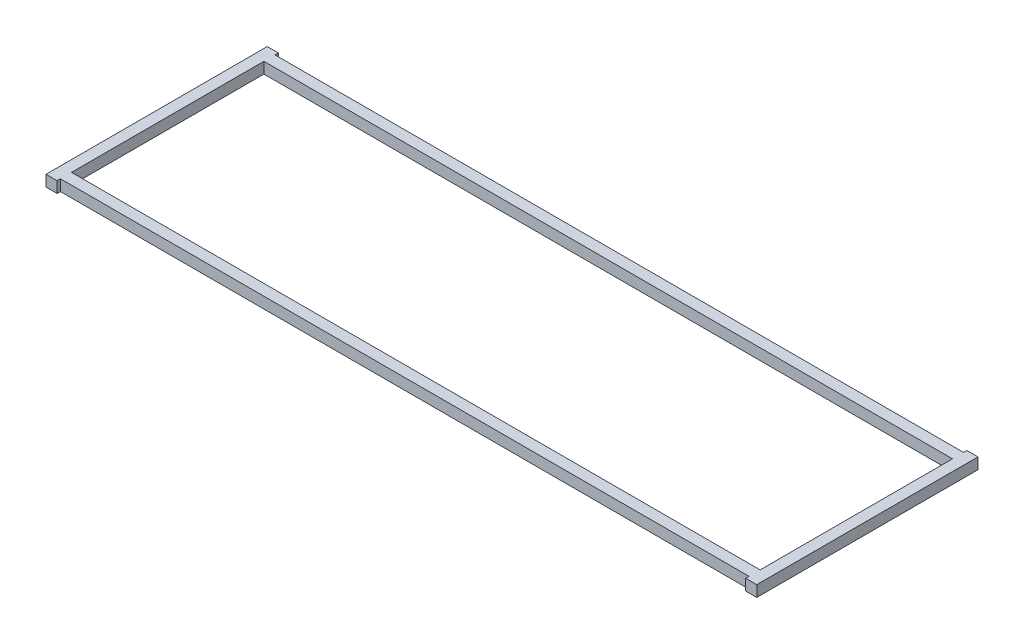
from build123d import *

# Parameters (mm, degrees)
SKETCH1_W           = 393.7
SKETCH1_H           = 109.98835
BOSS_EXTRUDE1_DEPTH = 6.35


with BuildPart() as part:
    # Sketch1 → Boss-Extrude1 (new body)
    with BuildSketch(Plane(origin=(0, 0, 0), x_dir=(1, 0, 0), z_dir=(0, 1, 0))):
        Polygon((196.85, 63.25235), (203.2, 63.25235), (203.2, -63.25235), (196.85, -63.25235), (196.85, -61.344175), (-196.85, -61.344175), (-196.85, -63.25235), (-203.2, -63.25235), (-203.2, 63.25235), (-196.85, 63.25235), (-196.85, 61.344175), (196.85, 61.344175), align=None)
        Rectangle(SKETCH1_W, SKETCH1_H, mode=Mode.SUBTRACT)
    extrude(amount=BOSS_EXTRUDE1_DEPTH)


solid = part.part
